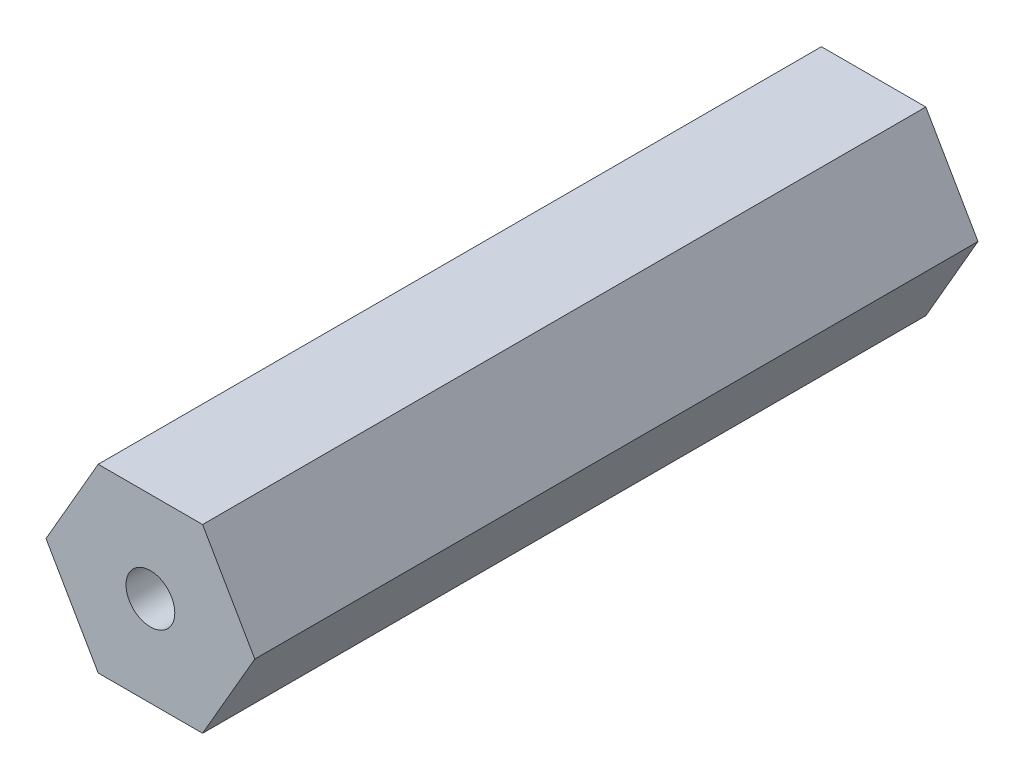
from build123d import *

# Parameters (mm, degrees)
SKETCH1_R           = 1.7145
BOSS_EXTRUDE1_DEPTH = 25.4


with BuildPart() as part:
    # Sketch1 → Boss-Extrude1 (new, symmetric)
    with BuildSketch(Plane.XY):
        Polygon((7.332348419, 0), (3.666174209, 6.35), (-3.666174209, 6.35), (-7.332348419, 0), (-3.666174209, -6.35), (3.666174209, -6.35), align=None)
        Circle(SKETCH1_R, mode=Mode.SUBTRACT)
    extrude(amount=BOSS_EXTRUDE1_DEPTH, both=True)


solid = part.part
